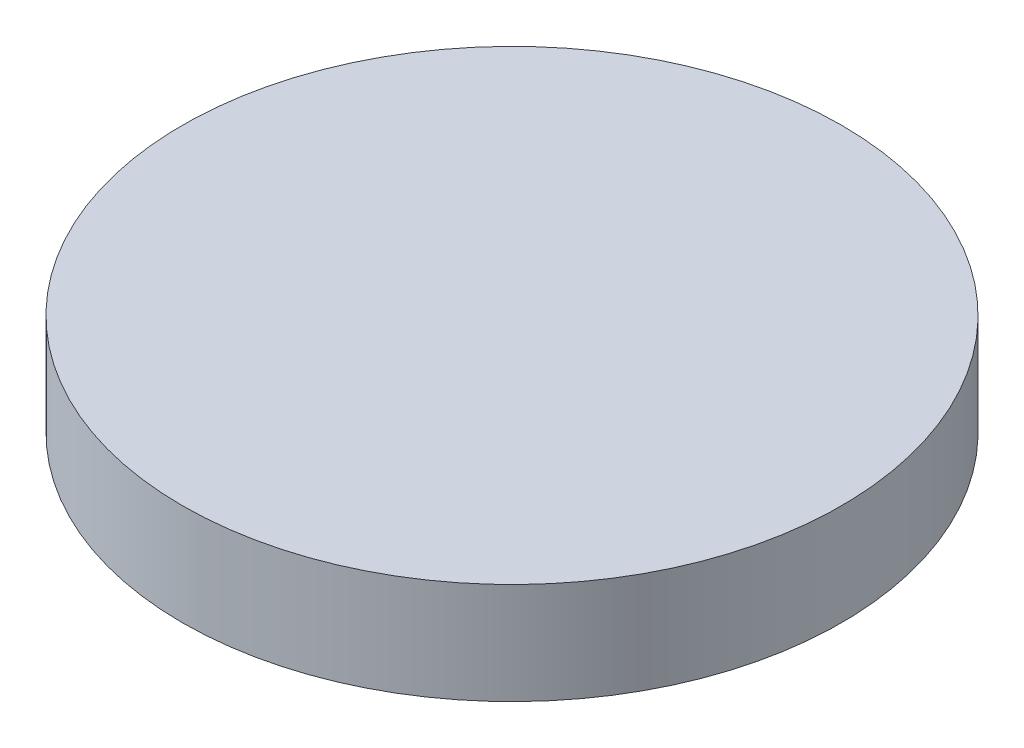
from build123d import *

# Parameters (mm, degrees)
CROQUIS1_R              = 13
SALIENTE_EXTRUIR1_DEPTH = 4


with BuildPart() as part:
    # Croquis1 → Saliente-Extruir1 (new body)
    with BuildSketch(Plane(origin=(0, 0, 0), x_dir=(1, 0, 0), z_dir=(0, 1, 0))):
        Circle(CROQUIS1_R)
    extrude(amount=SALIENTE_EXTRUIR1_DEPTH)


solid = part.part
